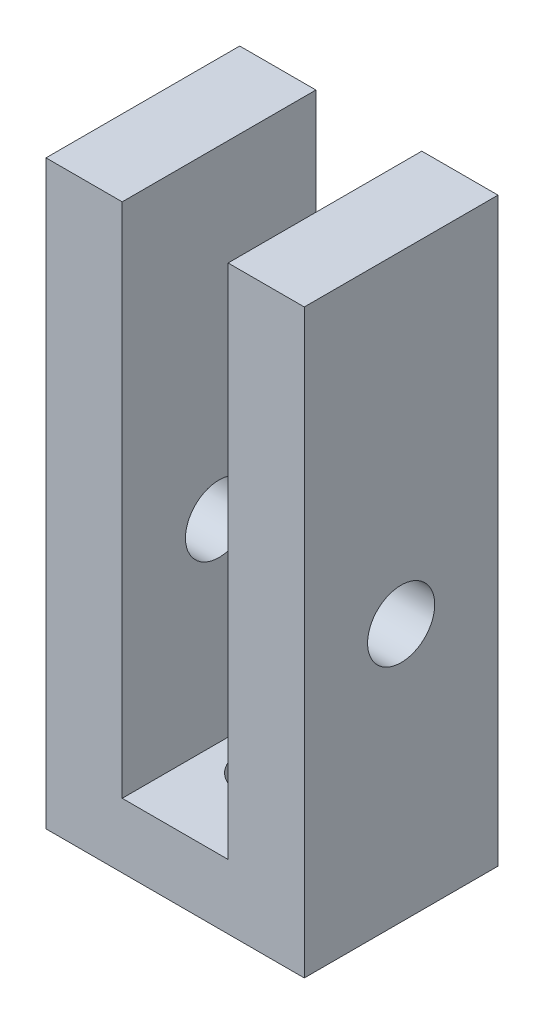
from build123d import *

# Parameters (mm, degrees)
SKETCH_5_W          = 20
SKETCH_5_H          = 15
EXTRUDE_5_DEPTH     = 5
CUT_EXTRUDE_6_REACH = 27.495
SKETCH_6_R          = 2.6
SKETCH_7_W          = 5.9
SKETCH_7_H          = 15
EXTRUDE_7_DEPTH     = 40
SKETCH_8_R          = 2.6
CUT_EXTRUDE_8_DEPTH = 52.478150705


with BuildPart() as part:
    # Эскиз5 → Вытянуть5 (new body)
    with BuildSketch(Plane(origin=(0, 0, 0), x_dir=(1, 0, 0), z_dir=(0, 1, 0))):
        with Locations((10, 7.5)):
            Rectangle(SKETCH_5_W, SKETCH_5_H)
    extrude(amount=EXTRUDE_5_DEPTH)

    # Эскиз6 → Вытянуть6 (cut, up to next)
    with BuildSketch(Plane(origin=(0, 5, 0), x_dir=(1, 0, 0), z_dir=(0, 1, 0)), mode=Mode.PRIVATE) as cut_extrude_6_sk1:
        with Locations((10, 7.5)):
            Circle(SKETCH_6_R)
    cut_extrude_6_tool1 = extrude(cut_extrude_6_sk1.sketch, amount=-CUT_EXTRUDE_6_REACH, mode=Mode.PRIVATE) & part.part
    add(cut_extrude_6_tool1.solids().sort_by_distance((10, 5, -7.5))[0], mode=Mode.SUBTRACT)

    # Эскиз7 → Вытянуть7 (add)
    with BuildSketch(Plane(origin=(0, 5, 0), x_dir=(1, 0, 0), z_dir=(0, 1, 0))):
        with Locations((2.95, 7.5)):
            Rectangle(SKETCH_7_W, SKETCH_7_H)
        with Locations((17.05, 7.5)):
            Rectangle(SKETCH_7_W, SKETCH_7_H)
    extrude(amount=EXTRUDE_7_DEPTH)

    # Эскиз8 → Вытянуть8 (cut, through all)
    with BuildSketch(Plane.ZY):
        with Locations((-7.5, 20)):
            Circle(SKETCH_8_R)
    extrude(amount=-CUT_EXTRUDE_8_DEPTH, mode=Mode.SUBTRACT)


solid = part.part
